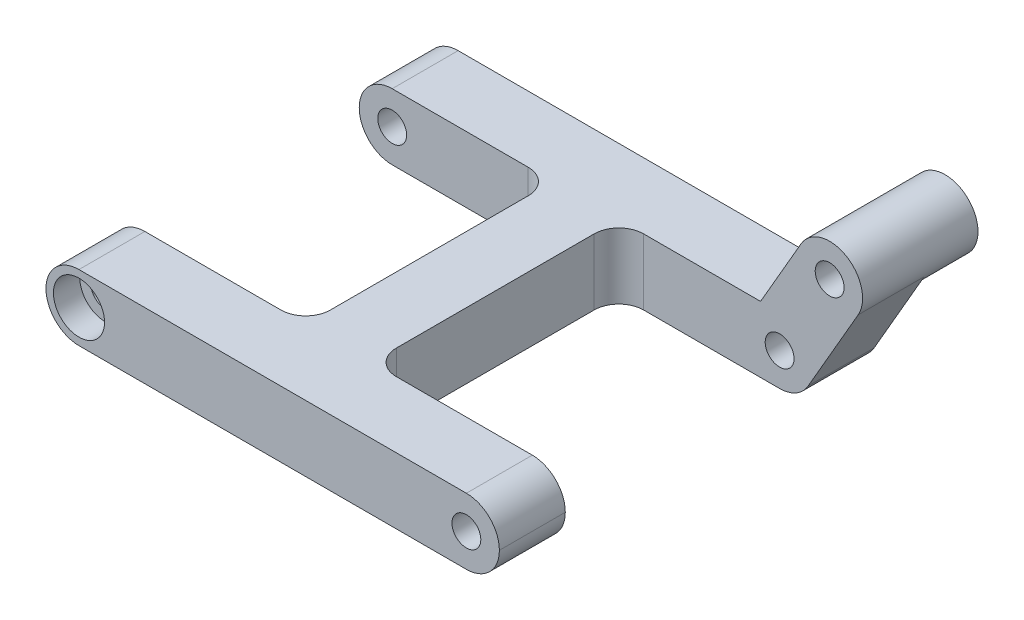
from build123d import *

# Parameters (mm, degrees)
SALIENTE_EXTRUIR1_DEPTH = 4
CROQUIS3_R              = 1.75
CORTAR_EXTRUIR1_DEPTH   = 54.742441329
REDONDEO8_R             = 4
REDONDEO9_R             = 3
SALIENTE_EXTRUIR3_START = -8
CROQUIS5_R              = 1.75
SALIENTE_EXTRUIR3_DEPTH = 8
CROQUIS4_R              = 4
CROQUIS4_R_2            = 1.75
SALIENTE_EXTRUIR2_DEPTH = 6
CROQUIS6_R              = 3.1
CORTAR_EXTRUIR2_DEPTH   = 3.2


with BuildPart() as part:
    # Croquis2 → Saliente-Extruir1 (new, symmetric)
    with BuildSketch(Plane(origin=(0, 0, 0), x_dir=(1, 0, 0), z_dir=(0, 1, 0))):
        Polygon((27.5, -23), (27.5, -15), (4, -15), (4, 15), (27.5, 15), (27.5, 23), (-27.5, 23), (-27.5, 15), (-4, 15), (-4, -15), (-27.5, -15), (-27.5, -23), align=None)
    extrude(amount=SALIENTE_EXTRUIR1_DEPTH, both=True)

    # Croquis3 → Cortar-Extruir1 (cut, through all)
    with BuildSketch(Plane.XY.offset(23)):
        with Locations((23.5, 0)):
            Circle(CROQUIS3_R)
        with Locations((-23.5, 0)):
            Circle(CROQUIS3_R)
    extrude(amount=-CORTAR_EXTRUIR1_DEPTH, mode=Mode.SUBTRACT)

    # Redondeo8
    redondeo8_edges = [part.edges().sort_by_distance(p)[0] for p in [
        (27.5, -4, -19),
        (27.5, 4, -19),
        (27.5, -4, 19),
        (27.5, 4, 19),
        (-27.5, -4, -19),
        (-27.5, 4, -19),
        (-27.5, -4, 19),
        (-27.5, 4, 19),
    ]]
    fillet(redondeo8_edges, radius=REDONDEO8_R - 0.0001)  # a hair under: the kernel refuses the full size

    # Redondeo9
    redondeo9_edges = [part.edges().sort_by_distance(p)[0] for p in [
        (4, 0, -15),
        (4, 0, 15),
        (-4, 0, 15),
        (-4, 0, -15),
    ]]
    fillet(redondeo9_edges, radius=REDONDEO9_R)

    # Croquis5 → Saliente-Extruir3 (add)
    with BuildSketch(Plane(origin=(0, 0, -23), x_dir=(-1, 0, 0), z_dir=(0, 0, -1)).offset(SALIENTE_EXTRUIR3_START)):
        with BuildLine():
            Line((-26.103713296, 12.509763717), (-20.035898385, 2))
            ThreePointArc((-20.035898385, 2), (-21.5, -3.464101615), (-26.964101615, -2))
            Line((-26.964101615, -2), (-33.031916526, 8.509763717))
            ThreePointArc((-33.031916526, 8.509763717), (-31.567814911, 13.973865332), (-26.103713296, 12.509763717))
        make_face()
        with Locations(Location((-23.5, 0, 0), (0, 0, 180))):
            Circle(CROQUIS5_R, mode=Mode.SUBTRACT)
        with Locations((-29.567814911, 10.509763717)):
            Circle(CROQUIS5_R, mode=Mode.SUBTRACT)
    extrude(amount=SALIENTE_EXTRUIR3_DEPTH)

    # Croquis4 → Saliente-Extruir2 (add)
    with BuildSketch(Plane.XY.offset(-23)):
        with Locations(Location((29.567814911, 10.509763717, 0), (0, 0, 150))):
            Circle(CROQUIS4_R)
        with Locations(Location((29.567814911, 10.509763717, 0), (0, 0, 180))):
            Circle(CROQUIS4_R_2, mode=Mode.SUBTRACT)
    extrude(amount=-SALIENTE_EXTRUIR2_DEPTH)

    # Croquis6 → Cortar-Extruir2 (cut)
    with BuildSketch(Plane.XY.offset(23)):
        with Locations((-23.5, 0)):
            Circle(CROQUIS6_R)
    extrude(amount=-CORTAR_EXTRUIR2_DEPTH, mode=Mode.SUBTRACT)


solid = part.part
